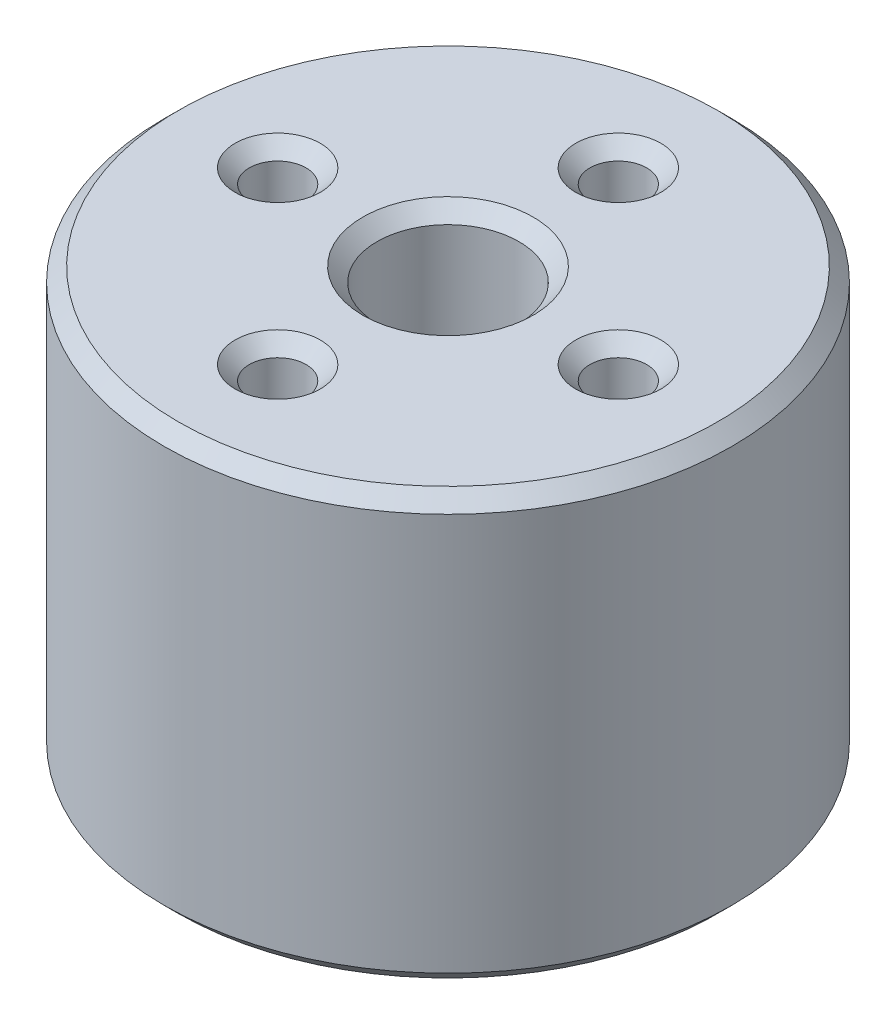
from build123d import *

# Parameters (mm, degrees)
SKETCH_1_R               = 10
SKETCH_1_R_2             = 2.5
EXTRUDE_1_DEPTH          = 15
SKETCH_2_R               = 1
CUT_EXTRUDE_1_DEPTH      = 15
PATTERN_CIRCULAR_1_COUNT = 4
CHAMFER_1_SIZE           = 0.5


with BuildPart() as part:
    # 草图1 → 凸台-拉伸1 (new body)
    with BuildSketch(Plane(origin=(0, 0, 0), x_dir=(1, 0, 0), z_dir=(0, 1, 0))):
        Circle(SKETCH_1_R)
        Circle(SKETCH_1_R_2, mode=Mode.SUBTRACT)
    extrude(amount=EXTRUDE_1_DEPTH)

    # 草图2 → 切除-拉伸1 (cut)
    with BuildSketch(Plane(origin=(0, 15, 0), x_dir=(1, 0, 0), z_dir=(0, 1, 0))):
        with Locations((-6, 0)):
            Circle(SKETCH_2_R)
    cut_extrude_1 = extrude(amount=-CUT_EXTRUDE_1_DEPTH, mode=Mode.SUBTRACT)

    # 阵列(圆周)1: 切除-拉伸1 ×4 about axis
    pattern_circular_1_axis = Axis((0, 15, 0), (0, -1, 0))
    for i in range(1, PATTERN_CIRCULAR_1_COUNT):
        add(cut_extrude_1.rotate(pattern_circular_1_axis, i * 360 / PATTERN_CIRCULAR_1_COUNT), mode=Mode.SUBTRACT)

    # 倒角1
    chamfer_1_edges = [part.edges().sort_by_distance(p)[0] for p in [
        (-10, 0, 0),
        (-10, 15, 0),
        (0, 15, -7),
        (0, 0, -7),
        (7, 15, 0),
        (7, 0, 0),
        (-2.5, 0, 0),
        (-2.5, 15, 0),
        (0, 15, 7),
        (0, 0, 7),
        (-7, 15, 0),
        (-7, 0, 0),
    ]]
    chamfer(chamfer_1_edges, length=CHAMFER_1_SIZE)


solid = part.part
